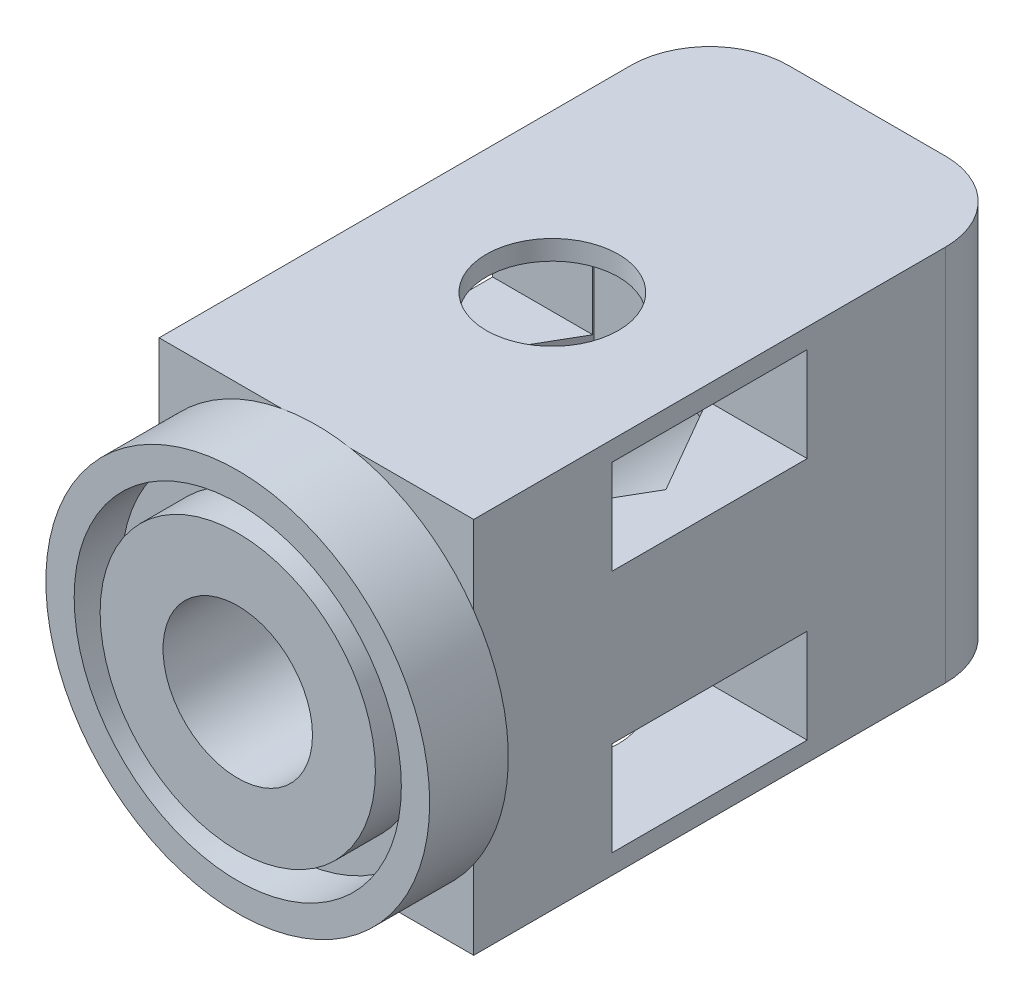
from build123d import *
from build123d.topology import SkipClean

# Parameters (mm, degrees)
SKETCH4_W                = 20
SKETCH4_H                = 22
SKETCH4_R                = 4.75
BOSS_EXTRUDE2_DEPTH      = 30
CUT_EXTRUDE1_DEPTH       = 30
BOSS_EXTRUDE3_START      = 1
SKETCH11_W               = 20
SKETCH11_H               = 30
SKETCH11_R               = 4.2
BOSS_EXTRUDE3_DEPTH      = 1
SKETCH12_W               = 20
SKETCH12_H               = 30
SKETCH12_R               = 4.2
BOSS_EXTRUDE4_DEPTH      = 1
CUT_EXTRUDE2_DEPTH       = 10.75
SKETCH16_R               = 12.2
BOSS_EXTRUDE7_DEPTH      = 2
CUT_EXTRUDE3_START       = -2
SKETCH18_R               = 4.75
CUT_EXTRUDE3_DEPTH       = 2
BOSS_EXTRUDE8_START      = 3
SKETCH19_R               = 12.2
SKETCH19_R_2             = 10.4
SKETCH19_R_3             = 8.75
SKETCH19_R_4             = 4.75
BOSS_EXTRUDE8_DEPTH      = 3
SKETCH21_W               = 20
SKETCH21_H               = 24
SKETCH21_R               = 4.75
BOSS_EXTRUDE9_DEPTH      = 5
FILLET1_R                = 5
CUT_EXTRUDE12_DEPTH      = 44.205092
CUT_EXTRUDE12_DEPTH_BACK = 44.205092


with BuildPart() as part:
    # Sketch4 → Boss-Extrude2 (new body)
    with BuildSketch(Plane.XY):
        Rectangle(SKETCH4_W, SKETCH4_H)
        Circle(SKETCH4_R, mode=Mode.SUBTRACT)
    extrude(amount=-BOSS_EXTRUDE2_DEPTH)

    # Sketch7 → Cut-Extrude1 (cut)
    with BuildSketch(Plane.XZ.offset(11)):
        with BuildLine():
            ThreePointArc((4.2, -15), (2.969848, -12.030152), (0, -10.8))
            Line((0, -10.8), (0, -19.2))
            ThreePointArc((0, -19.2), (2.969848, -17.969848), (4.2, -15))
        make_face()
        with BuildLine():
            Line((0, -19.2), (0, -10.8))
            ThreePointArc((0, -10.8), (-4.2, -15), (0, -19.2))
        make_face()
    extrude(amount=-CUT_EXTRUDE1_DEPTH, mode=Mode.SUBTRACT)

    # Sketch11 → Boss-Extrude3 (add)
    with BuildSketch(Plane.XZ.offset(11).offset(BOSS_EXTRUDE3_START)):
        with Locations((0, -15)):
            Rectangle(SKETCH11_W, SKETCH11_H)
        with Locations((0, -15)):
            Circle(SKETCH11_R, mode=Mode.SUBTRACT)
    extrude(amount=-BOSS_EXTRUDE3_DEPTH)

    # Sketch12 → Boss-Extrude4 (add)
    with SkipClean():  # the faces are left unmerged after this step: merging them gives an invalid solid
        with BuildSketch(Plane(origin=(0, 11, 0), x_dir=(1, 0, 0), z_dir=(0, 1, 0))):
            with Locations((0, 15)):
                Rectangle(SKETCH12_W, SKETCH12_H)
            with Locations((0, 15)):
                Circle(SKETCH12_R, mode=Mode.SUBTRACT)
        extrude(amount=BOSS_EXTRUDE4_DEPTH)

    # Sketch9 → Cut-Extrude2 (cut, symmetric)
    with SkipClean():  # the faces are left unmerged after this step: merging them gives an invalid solid
        with BuildSketch(Plane(origin=(0, 0, 0), x_dir=(-1, 0, 0), z_dir=(0, -1, 0))):
            Polygon((7.216878, 15), (3.608439, 21.25), (-3.608439, 21.25), (-7.216878, 15), (-3.608439, 8.75), (3.608439, 8.75), align=None)
        extrude(amount=CUT_EXTRUDE2_DEPTH, both=True, mode=Mode.SUBTRACT)

    # Sketch16 → Boss-Extrude7 (add)
    with SkipClean():  # the faces are left unmerged after this step: merging them gives an invalid solid
        with BuildSketch(Plane.XY):
            with Locations(Location((0, 0, 0), (0, 0, 145.051986))):
                Circle(SKETCH16_R)
        extrude(amount=BOSS_EXTRUDE7_DEPTH)

    # Sketch18 → Cut-Extrude3 (cut)
    with SkipClean():  # the faces are left unmerged after this step: merging them gives an invalid solid
        with BuildSketch(Plane(origin=(0, 0, 0), x_dir=(-1, 0, 0), z_dir=(0, 0, -1)).offset(CUT_EXTRUDE3_START)):
            with Locations(Location((0, 0, 0), (0, 0, 139.435238))):
                Circle(SKETCH18_R)
        extrude(amount=CUT_EXTRUDE3_DEPTH, mode=Mode.SUBTRACT)

    # Sketch19 → Boss-Extrude8 (add)
    # profile 1 of 2: a face of its own
    with SkipClean():  # the faces are left unmerged after this step: merging them gives an invalid solid
        with BuildSketch(Plane.XY.offset(2).offset(BOSS_EXTRUDE8_START)):
            with Locations(Location((0, 0, 0), (0, 0, 145.051986))):
                Circle(SKETCH19_R)
            Circle(SKETCH19_R_2, mode=Mode.SUBTRACT)
        # profile 2 of 2: a face of its own
        with BuildSketch(Plane.XY.offset(2).offset(BOSS_EXTRUDE8_START)):
            Circle(SKETCH19_R_3)
            Circle(SKETCH19_R_4, mode=Mode.SUBTRACT)
        extrude(amount=-BOSS_EXTRUDE8_DEPTH)

    # Sketch21 → Boss-Extrude9 (add)
    with SkipClean():  # the faces are left unmerged after this step: merging them gives an invalid solid
        with BuildSketch(Plane(origin=(0, 0, -30), x_dir=(-1, 0, 0), z_dir=(0, 0, -1))):
            Rectangle(SKETCH21_W, SKETCH21_H)
            with Locations(Location((0, 0, 0), (0, 0, 180))):
                Circle(SKETCH21_R, mode=Mode.SUBTRACT)
        extrude(amount=BOSS_EXTRUDE9_DEPTH)

    # Fillet1
    fillet1_edges = [part.edges().sort_by_distance(p)[0] for p in [
        (10, 0, -35),
        (-10, 0, -35),
    ]]
    fillet(fillet1_edges, radius=FILLET1_R - 0.0001)  # a hair under: the kernel refuses the full size

    # Sketch27 → Cut-Extrude12 (cut, two sides: drawn at the far end of the back side and taken through both)
    with BuildSketch(Plane.ZY.offset(10).offset(-CUT_EXTRUDE12_DEPTH_BACK)):
        Polygon((-15, 10.75), (-8.8, 10.75), (-8.8, 4.75), (-21.2, 4.75), (-21.2, 10.75), align=None)
        Polygon((-21.2, -10.75), (-21.2, -4.75), (-8.8, -4.75), (-8.8, -10.75), (-15, -10.75), align=None)
    extrude(amount=CUT_EXTRUDE12_DEPTH + CUT_EXTRUDE12_DEPTH_BACK, mode=Mode.SUBTRACT)


solid = part.part
